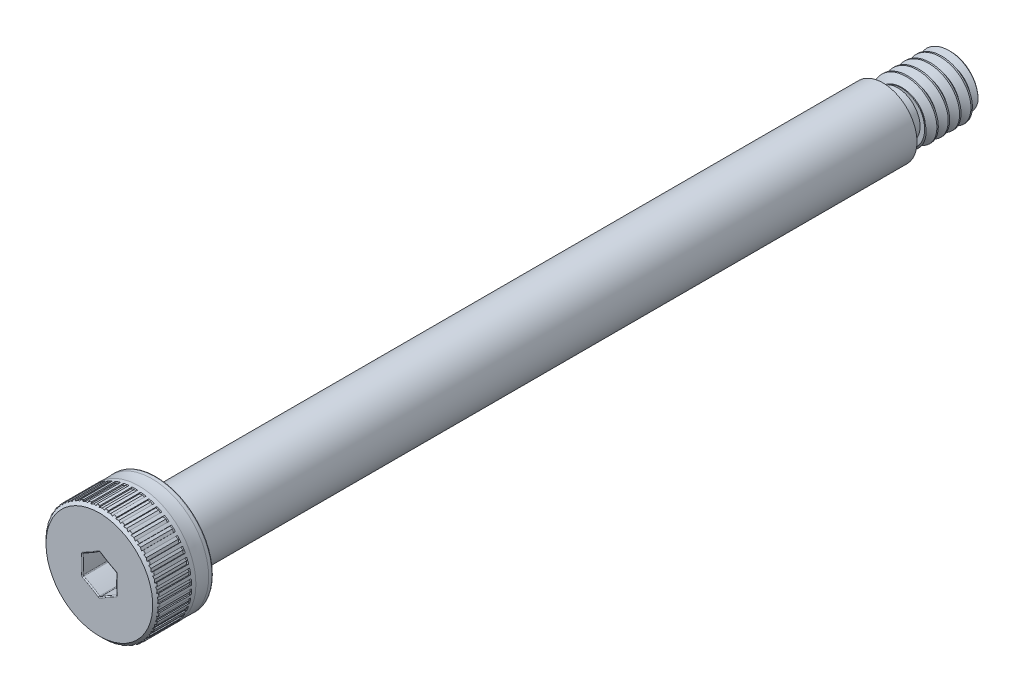
from build123d import *

# Parameters (mm, degrees)
SKETCH4_W             = 0.9921875
SKETCH4_H             = 0.238125
SKETCH4_W_2           = 1.031875
SKETCH4_H_2           = 0.515555748
CHAMFER1_SIZE         = 0.238125
FILLET1_R             = 0.142875
FILLET2_R             = 0.15875
CHAMFER2_SIZE         = 0.1984375
CHAMFER3_SIZE         = 0.238125
CUT_EXTRUDE1_DEPTH    = 2.0828
FILLET4_R             = 0.0714375
DELETEFACE1_START     = -51.831875
DELETEFACE1_OUTLINE_W = 6
DELETEFACE1_OUTLINE_H = 6
DELETEFACE1_OUTLINE_R = 1.567244252
DELETEFACE1_DEPTH     = 0.1587501
CUT_SWEEP1_PITCH      = 0.79375
CUT_EXTRUDE2_REACH    = 61.795
CIRPATTERN1_COUNT     = 42
FILLET5_R             = 0.0508


# Read off the part's stored shape, not the designer's step: DeleteFace1, CirPattern2
with BuildPart() as part:
    # Sketch3 → Revolve1 (revolve)
    with BuildSketch(Plane(origin=(0, 0, 0), x_dir=(0, 0, -1), z_dir=(1, 0, 0)), mode=Mode.PRIVATE) as revolve1_sk:
        Polygon((-3.96875, 3.96875), (0, 3.96875), (0, 2.38125), (50.8, 2.38125), (50.8, 2.0828), (55.5625, 2.0828), (55.5625, 0), (-3.96875, 0), align=None)
    revolve(revolve1_sk.sketch.rotate(Axis((0, 0, 3.96875), (0, 0, -1)), 90), axis=Axis((0, 0, 3.96875), (0, 0, -1)))

    # Sketch4 → Cut-Revolve1 (revolve, cut)
    with BuildSketch(Plane(origin=(0, 0, 0), x_dir=(0, 0, -1), z_dir=(1, 0, 0)), mode=Mode.PRIVATE) as cut_revolve1_sk:
        with Locations((0.49609375, 2.2621875)):
            Rectangle(SKETCH4_W, SKETCH4_H)
        with Locations((51.3159375, 1.825022126)):
            Rectangle(SKETCH4_W_2, SKETCH4_H_2)
    revolve(cut_revolve1_sk.sketch.rotate(Axis((0, 0, 3.96875), (0, 0, -1)), 90), axis=Axis((0, 0, 3.96875), (0, 0, -1)), mode=Mode.SUBTRACT)

    # Chamfer1
    chamfer1_edges = [part.edges().sort_by_distance(p)[0] for p in [
        (-2.143125, 0, -0.9921875),
    ]]
    chamfer(chamfer1_edges, length=CHAMFER1_SIZE - 0.0001)  # a hair under: the kernel refuses the full size

    # Fillet1
    fillet1_edges = [part.edges().sort_by_distance(p)[0] for p in [
        (-2.143125, 0, 0),
    ]]
    fillet(fillet1_edges, radius=FILLET1_R)

    # Fillet2
    fillet2_edges = [part.edges().sort_by_distance(p)[0] for p in [
        (-1.567244252, 0, -50.8),
        (-1.567244252, 0, -51.831875),
    ]]
    fillet(fillet2_edges, radius=FILLET2_R)

    # Chamfer2
    chamfer2_edges = [part.edges().sort_by_distance(p)[0] for p in [
        (-2.0828, 0, -51.831875),
        (-2.0828, 0, -55.5625),
    ]]
    chamfer(chamfer2_edges, length=CHAMFER2_SIZE)

    # Chamfer3
    chamfer3_edges = [part.edges().sort_by_distance(p)[0] for p in [
        (-3.96875, 0, 3.96875),
    ]]
    chamfer(chamfer3_edges, length=CHAMFER3_SIZE)

    # Sketch5 → Cut-Extrude1 (cut)
    with BuildSketch(Plane.XY.offset(3.96875)):
        with BuildLine():
            ThreePointArc((1.190625, 0.687407664), (0.58340625, 1.010489266), (0, 1.374815329))
            ThreePointArc((0, 1.374815329), (-0.58340625, 1.010489266), (-1.190625, 0.687407664))
            ThreePointArc((-1.190625, 0.687407664), (-1.1668125, 0), (-1.190625, -0.687407664))
            ThreePointArc((-1.190625, -0.687407664), (-0.58340625, -1.010489266), (0, -1.374815329))
            ThreePointArc((0, -1.374815329), (0.58340625, -1.010489266), (1.190625, -0.687407664))
            ThreePointArc((1.190625, -0.687407664), (1.1668125, 0), (1.190625, 0.687407664))
        make_face()
    extrude(amount=-CUT_EXTRUDE1_DEPTH, mode=Mode.SUBTRACT)

    # Fillet4
    fillet4_edges = [part.edges().sort_by_distance(p)[0] for p in [
        (1.1668125, 0, 1.88595),
        (1.190625, 0.687407664, 2.92735),
        (0.58340625, -1.010489266, 1.88595),
        (1.190625, -0.687407664, 2.92735),
        (-0.58340625, -1.010489266, 1.88595),
        (0, -1.374815329, 2.92735),
        (-1.1668125, 0, 1.88595),
        (-1.190625, -0.687407664, 2.92735),
        (-0.58340625, 1.010489266, 1.88595),
        (-1.190625, 0.687407664, 2.92735),
        (0.58340625, 1.010489266, 1.88595),
        (0, 1.374815329, 2.92735),
        (1.1668125, 0, 3.96875),
        (0.58340625, 1.010489266, 3.96875),
        (-0.58340625, 1.010489266, 3.96875),
        (-1.1668125, 0, 3.96875),
        (-0.58340625, -1.010489266, 3.96875),
        (0.58340625, -1.010489266, 3.96875),
        (-3.96875, 0, 0),
    ]]
    fillet(fillet4_edges, radius=FILLET4_R)

    # DeleteFace1 outline → DeleteFace1 (cut)
    with BuildSketch(Plane.XY.offset(DELETEFACE1_START)):
        Rectangle(DELETEFACE1_OUTLINE_W, DELETEFACE1_OUTLINE_H)
        Circle(DELETEFACE1_OUTLINE_R, mode=Mode.SUBTRACT)
    extrude(amount=DELETEFACE1_DEPTH, mode=Mode.SUBTRACT)

    # Cut-Sweep1: the profile of Sketch7 profile screwed along a right-hand helix of 5.48 turns, 8 arcs to a turn; built about Z, then put on its axis
    cut_sweep1_z = Axis((0, 0, 0), (0, 0, 1))
    cut_sweep1_corners = [(2.125762979, 0, 0.024804687), (2.125762979, 0, -0.719335938), (1.566944252, 0, -0.396701795), (1.566944252, 0, -0.297829455)]
    with BuildLine(mode=Mode.PRIVATE) as cut_sweep1_profile:
        Line(cut_sweep1_corners[0], cut_sweep1_corners[1])
        Line(cut_sweep1_corners[1], cut_sweep1_corners[2])
        Line(cut_sweep1_corners[2], cut_sweep1_corners[3])
        Line(cut_sweep1_corners[3], cut_sweep1_corners[0])
    cut_sweep1_cap = Face(cut_sweep1_profile.wire())
    cut_sweep1_turn_angles = [0, 22.5, 45, 67.5, 90, 112.5, 135, 157.5, 180, 202.5, 225, 247.5, 270, 292.5, 315, 337.5, 360]
    cut_sweep1_turn_weights = [1, 0.9238795325112867, 1, 0.9238795325112867, 1, 0.9238795325112867, 1, 0.9238795325112867, 1, 0.9238795325112867, 1, 0.9238795325112867, 1, 0.9238795325112867, 1, 0.9238795325112867, 1]
    cut_sweep1_turn_rails = [Edge.make_bspline([Vector(p[0], p[1], 0).rotate(cut_sweep1_z, cut_sweep1_turn_angles[k]) / cut_sweep1_turn_weights[k] + Vector(0, 0, p[2] + CUT_SWEEP1_PITCH * cut_sweep1_turn_angles[k] / 360) for k in range(17)], [0, 0, 0, 1, 1, 2, 2, 3, 3, 4, 4, 5, 5, 6, 6, 7, 7, 8, 8, 8], 2, cut_sweep1_turn_weights) for p in cut_sweep1_corners]
    cut_sweep1_turn_sides = [Face.make_surface_from_curves(cut_sweep1_turn_rails[p[0]], cut_sweep1_turn_rails[p[1]]) for p in [(0, 1), (1, 2), (2, 3), (3, 0)]]
    cut_sweep1_last_angles = [1800, 1822.5, 1845, 1867.5, 1890, 1912.5, 1935, 1953.9, 1972.8]
    cut_sweep1_last_weights = [1, 0.9238795325112867, 1, 0.9238795325112867, 1, 0.9238795325112867, 1, 0.9460853588275429, 1]
    cut_sweep1_last_rails = [Edge.make_bspline([Vector(p[0], p[1], 0).rotate(cut_sweep1_z, cut_sweep1_last_angles[k]) / cut_sweep1_last_weights[k] + Vector(0, 0, p[2] + CUT_SWEEP1_PITCH * cut_sweep1_last_angles[k] / 360) for k in range(9)], [0, 0, 0, 1, 1, 2, 2, 3, 3, 4, 4, 4], 2, cut_sweep1_last_weights) for p in cut_sweep1_corners]
    cut_sweep1_last_sides = [Face.make_surface_from_curves(cut_sweep1_last_rails[p[0]], cut_sweep1_last_rails[p[1]]) for p in [(0, 1), (1, 2), (2, 3), (3, 0)]]
    cut_sweep1 = Plane(origin=(0, 0, -55.5625), x_dir=(0, 1, 0), z_dir=(0, 0, 1)) * Solid(Shell([*[p.moved(Location((0, 0, CUT_SWEEP1_PITCH * i))) for i in range(5) for p in cut_sweep1_turn_sides], *cut_sweep1_last_sides, cut_sweep1_cap, cut_sweep1_cap.rotate(cut_sweep1_z, 1972.8).moved(Location((0, 0, CUT_SWEEP1_PITCH * 1972.8 / 360)))]))
    add(cut_sweep1, mode=Mode.SUBTRACT)

    # Cut-Extrude2: up to this plane
    cut_extrude2_end = Plane(origin=(0, 4.845728137, 0.611303113), z_dir=(0, 0.707106781186546, 0.7071067811865491))
    # Sketch8 → Cut-Extrude2 (cut, up to the surface)
    with BuildSketch(Plane.XY.offset(3.96875), mode=Mode.PRIVATE) as cut_extrude2_sk1:
        Polygon((-0.1905, 3.96875), (0.1905, 3.96875), (0.182491057, 3.89255), (0, 3.93065), (-0.182491057, 3.89255), align=None)
    cut_extrude2_tool1 = split(extrude(cut_extrude2_sk1.sketch, amount=-CUT_EXTRUDE2_REACH, mode=Mode.PRIVATE), bisect_by=cut_extrude2_end, keep=Keep.BOTH, mode=Mode.PRIVATE)
    cut_extrude2 = cut_extrude2_tool1.solids().sort_by_distance((0, 3.939237, 3.96875))[0]
    add(cut_extrude2, mode=Mode.SUBTRACT)

    # CirPattern1: Cut-Extrude2 ×42 about axis
    cirpattern1_axis = Axis((0, 0, 0), (0, 0, 1))
    for i in range(1, CIRPATTERN1_COUNT):
        add(cut_extrude2.rotate(cirpattern1_axis, i * 360 / CIRPATTERN1_COUNT), mode=Mode.SUBTRACT)

    # Fillet5
    fillet5_edges = [part.edges().sort_by_distance(p)[0] for p in [
        (0.296585059, 3.95765257, 3.730625),
    ]]
    fillet(fillet5_edges, radius=FILLET5_R)

    # CirPattern2 outline → CirPattern2 (revolve, cut)
    with BuildSketch(Plane.XZ):
        with BuildLine():
            ThreePointArc((3.953871024, 3.745503976), (3.96488308, 3.72902327), (3.96875, 3.709582951))
            Line((3.96875, 3.709582951), (3.96875, 3.745503976))
            Line((3.96875, 3.745503976), (3.953871024, 3.745503976))
        make_face()
    revolve(axis=Axis((0, 0, 0), (0, 0, 1)), mode=Mode.SUBTRACT)

    # Sketch11 → Cut-Revolve6 (revolve, cut)
    with BuildSketch(Plane(origin=(0, 0, 0), x_dir=(0, 0, -1), z_dir=(1, 0, 0)), mode=Mode.PRIVATE) as cut_revolve6_sk:
        with BuildLine():
            Line((-1.190625, 3.96875), (-0.29765625, 3.96875))
            ThreePointArc((-0.29765625, 3.96875), (-0.744140625, 3.95097), (-1.190625, 3.96875))
        make_face()
    revolve(cut_revolve6_sk.sketch.rotate(Axis((0, 0, 3.96875), (0, 0, -1)), 90), axis=Axis((0, 0, 3.96875), (0, 0, -1)), mode=Mode.SUBTRACT)


solid = part.part
